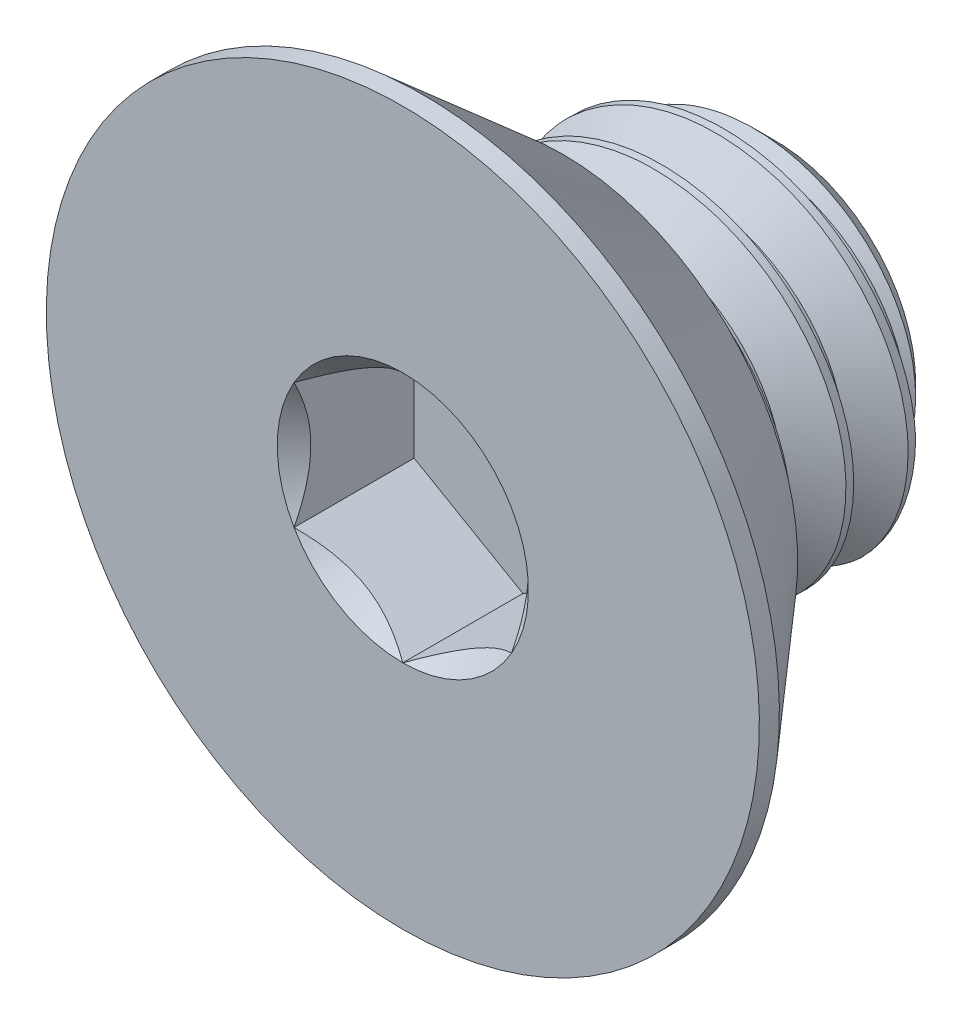
from build123d import *

# Parameters (mm, degrees)
CUT_EXTRUDE1_DEPTH  = 3.06705
SKETCH5_R           = 3.207902433
CUT_EXTRUDE2_DEPTH  = 3.06705
CUT_EXTRUDE2_TAPER  = 45
CUT_SWEEP1_PITCH    = 1.5875
CUT_SWEEP1_TO       = 5.4356
SKETCH8_R           = 4.714875
BOSS_EXTRUDE1_DEPTH = 2.7178
BOSS_EXTRUDE1_DRAFT = -39


with BuildPart() as part:
    # Sketch2 → Revolve1 (revolve)
    with BuildSketch(Plane(origin=(0, 0, 0), x_dir=(0, 0, -1), z_dir=(1, 0, 0)), mode=Mode.PRIVATE) as revolve1_sk:
        Polygon((-4.7625, 0), (4.7625, 0), (4.7625, 3.571875), (3.571875, 4.7625), (-0.6731, 4.7625), (-0.6731, 5.995396463), (-4.251325, 9.1059), (-4.7625, 9.1059), align=None)
    revolve(revolve1_sk.sketch.rotate(Axis((0, 0, 4.7625), (0, 0, -1)), 180), axis=Axis((0, 0, 4.7625), (0, 0, -1)))

    # Sketch4 → Cut-Extrude1 (cut)
    with BuildSketch(Plane.XY.offset(4.7625)):
        Polygon((2.778125, -1.603951217), (2.778125, 1.603951217), (0, 3.207902433), (-2.778125, 1.603951217), (-2.778125, -1.603951217), (0, -3.207902433), align=None)
    extrude(amount=-CUT_EXTRUDE1_DEPTH, mode=Mode.SUBTRACT)

    # Sketch5 → Cut-Extrude2 (cut)
    with BuildSketch(Plane.XY.offset(4.7625)):
        Circle(SKETCH5_R)
    extrude(amount=-CUT_EXTRUDE2_DEPTH, taper=CUT_EXTRUDE2_TAPER, mode=Mode.SUBTRACT)


with BuildPart() as body_2:
    # Split1: the piece on the far side of the plane
    add(part.part)
    split(bisect_by=Plane.XY.offset(0.6731), keep=Keep.BOTTOM)

    # Cut-Sweep1: arcs per turn and ends read off the stored shape
    # Cut-Sweep1: the profile of Sketch7 screwed along a right-hand helix through 6 turns, 8 arcs to a turn; built about Z, then put on its axis
    cut_sweep1_z = Axis((0, 0, 0), (0, 0, 1))
    cut_sweep1_corners = [(4.848425958, 0, 0.049609375), (4.848425958, 0, -1.438671875), (3.731388504, 0, -0.79375), (3.731388504, 0, -0.5953125)]
    with BuildLine(mode=Mode.PRIVATE) as cut_sweep1_profile:
        Line(cut_sweep1_corners[0], cut_sweep1_corners[1])
        Line(cut_sweep1_corners[1], cut_sweep1_corners[2])
        Line(cut_sweep1_corners[2], cut_sweep1_corners[3])
        Line(cut_sweep1_corners[3], cut_sweep1_corners[0])
    cut_sweep1_cap = Face(cut_sweep1_profile.wire())
    cut_sweep1_turn_angles = [0, 22.5, 45, 67.5, 90, 112.5, 135, 157.5, 180, 202.5, 225, 247.5, 270, 292.5, 315, 337.5, 360]
    cut_sweep1_turn_weights = [1, 0.9238795325112867, 1, 0.9238795325112867, 1, 0.9238795325112867, 1, 0.9238795325112867, 1, 0.9238795325112867, 1, 0.9238795325112867, 1, 0.9238795325112867, 1, 0.9238795325112867, 1]
    cut_sweep1_turn_rails = [Edge.make_bspline([Vector(p[0], p[1], 0).rotate(cut_sweep1_z, cut_sweep1_turn_angles[k]) / cut_sweep1_turn_weights[k] + Vector(0, 0, p[2] + CUT_SWEEP1_PITCH * cut_sweep1_turn_angles[k] / 360) for k in range(17)], [0, 0, 0, 1, 1, 2, 2, 3, 3, 4, 4, 5, 5, 6, 6, 7, 7, 8, 8, 8], 2, cut_sweep1_turn_weights) for p in cut_sweep1_corners]
    cut_sweep1_turn_sides = [Face.make_surface_from_curves(cut_sweep1_turn_rails[p[0]], cut_sweep1_turn_rails[p[1]]) for p in [(0, 1), (1, 2), (2, 3), (3, 0)]]
    cut_sweep1 = Plane(origin=(0, 0, -4.7625), x_dir=(0, 1, 0), z_dir=(0, 0, 1)) * split(Solid(Shell([*[p.moved(Location((0, 0, CUT_SWEEP1_PITCH * i))) for i in range(6) for p in cut_sweep1_turn_sides], cut_sweep1_cap, cut_sweep1_cap.rotate(cut_sweep1_z, 2160).moved(Location((0, 0, CUT_SWEEP1_PITCH * 2160 / 360)))])), bisect_by=Plane.XY.offset(CUT_SWEEP1_TO), keep=Keep.BOTTOM, mode=Mode.PRIVATE)
    add(cut_sweep1, mode=Mode.SUBTRACT)


with BuildPart() as part_1:
    add(part.part)

    # Split1
    split(bisect_by=Plane.XY.offset(0.6731), keep=Keep.TOP)

    # Combine1: union body 2
    add(body_2.part)


with BuildPart() as boss_extrude1_tool:
    # Sketch8 → Boss-Extrude1 (with draft: the straight prism first)
    with BuildSketch(Plane.XY.offset(0.6731)):
        Circle(SKETCH8_R)
    extrude(amount=-BOSS_EXTRUDE1_DEPTH)
    # Boss-Extrude1: the draft: its side faces are tilted about the plane it starts from
    boss_extrude1_sides = [boss_extrude1_tool.faces().sort_by_distance(p)[0] for p in [
        (-4.714875, 0, -0.6858),
    ]]
    draft(boss_extrude1_sides, Plane.XY.offset(0.6731), BOSS_EXTRUDE1_DRAFT)


with BuildPart() as part_2:
    add(part_1.part)

    # Boss-Extrude1: add boss_extrude1_tool
    add(boss_extrude1_tool.part)


solid = part_2.part
